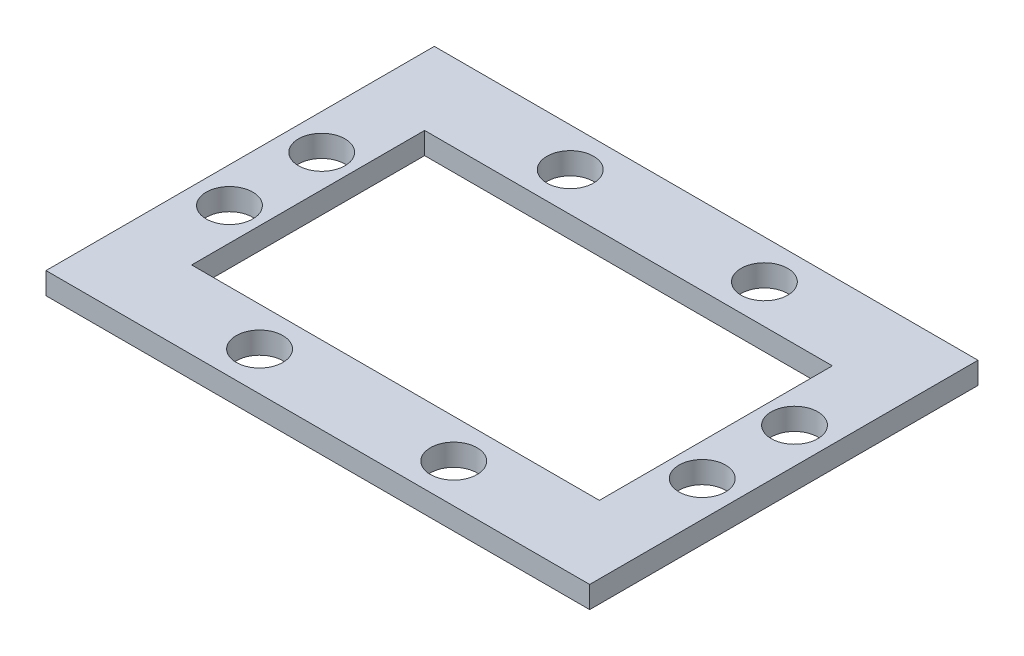
from build123d import *

# Parameters (mm, degrees)
SKETCH1_W           = 56
SKETCH1_H           = 40
SKETCH1_W_2         = 42
SKETCH1_H_2         = 24
SKETCH1_R           = 2.4
BOSS_EXTRUDE1_DEPTH = 2.25


with BuildPart() as part:
    # Sketch1 → Boss-Extrude1 (new body)
    with BuildSketch(Plane(origin=(0, 0, 0), x_dir=(1, 0, 0), z_dir=(0, 1, 0))):
        Rectangle(SKETCH1_W, SKETCH1_H)
        Rectangle(SKETCH1_W_2, SKETCH1_H_2, mode=Mode.SUBTRACT)
        with Locations((-24.35, 4.75)):
            Circle(SKETCH1_R, mode=Mode.SUBTRACT)
        with Locations((-24.35, -4.75)):
            Circle(SKETCH1_R, mode=Mode.SUBTRACT)
        with Locations((-10, -16)):
            Circle(SKETCH1_R, mode=Mode.SUBTRACT)
        with Locations((10, -16)):
            Circle(SKETCH1_R, mode=Mode.SUBTRACT)
        with Locations((24.35, -4.75)):
            Circle(SKETCH1_R, mode=Mode.SUBTRACT)
        with Locations((24.35, 4.75)):
            Circle(SKETCH1_R, mode=Mode.SUBTRACT)
        with Locations((10, 16)):
            Circle(SKETCH1_R, mode=Mode.SUBTRACT)
        with Locations((-10, 16)):
            Circle(SKETCH1_R, mode=Mode.SUBTRACT)
    extrude(amount=BOSS_EXTRUDE1_DEPTH)


solid = part.part
